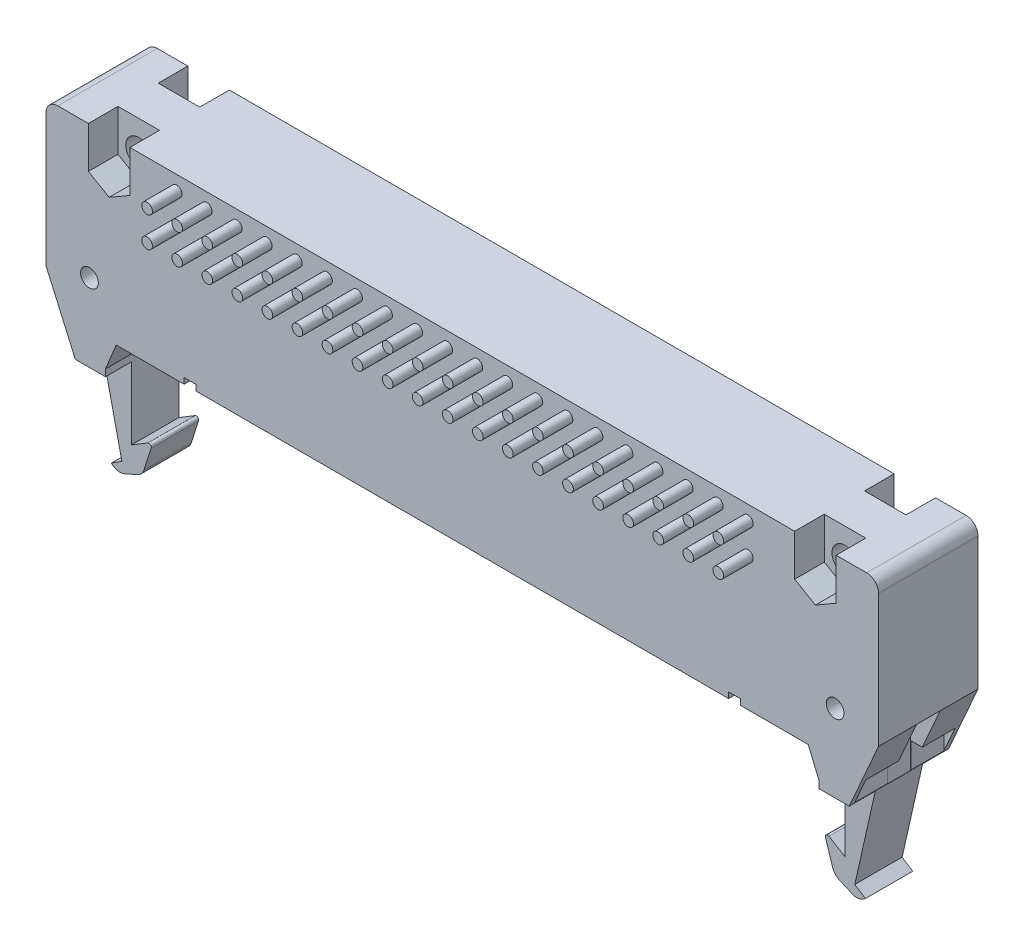
from build123d import *

# Parameters (mm, degrees)
EXTRUDE_1_DEPTH      = 8.4
SKETCH_2_W           = 3.875941336
SKETCH_2_H           = 10.635716013
CUT_EXTRUDE_1_DEPTH  = 150
SKETCH_3_W           = 2
SKETCH_3_H           = 5.614214587
CUT_EXTRUDE_2_DEPTH  = 2.5
SKETCH_4_W           = 7.533258122
SKETCH_4_H           = 2.2
CUT_EXTRUDE_3_DEPTH  = 2.45
SKETCH_5_W           = 2
SKETCH_5_H           = 5.614214587
CUT_EXTRUDE_4_DEPTH  = 2.5
SKETCH_6_W           = 2.766629061
SKETCH_6_H           = 2.133374911
CUT_EXTRUDE_5_DEPTH  = 2.45
SKETCH_7_W           = 58.464474368
SKETCH_7_H           = 5.5
CUT_EXTRUDE_6_DEPTH  = 10
SKETCH_8_R           = 0.45
EXTRUDE_2_DEPTH      = 8
SKETCH_9_R           = 1.1
SKETCH_9_R_2         = 0.75
SKETCH_9_W           = 1
SKETCH_9_H           = 0.97451262
CUT_EXTRUDE_7_DEPTH  = 10
SKETCH_10_W          = 52
SKETCH_10_H          = 2
CUT_EXTRUDE_8_DEPTH  = 2.5
CUT_EXTRUDE_9_DEPTH  = 2.5
SKETCH_12_W          = 4.6
SKETCH_12_H          = 9.297061896
CUT_EXTRUDE_10_DEPTH = 1.45
CHAMFER_1_SIZE       = 2
CUT_EXTRUDE_11_DEPTH = 0.2
SKETCH_14_R          = 0.45
EXTRUDE_3_DEPTH      = 2.5


with BuildPart() as part:
    # Эскиз1 → Вытянуть1 (new body)
    with BuildSketch(Plane.XY):
        with BuildLine():
            Line((-30.146127527, -11.858221261), (-29.232237184, -9.652950274))
            Line((-29.232237184, -9.652950274), (29.232237184, -9.652950274))
            Line((29.232237184, -9.652950274), (30.146127527, -11.858221261))
            Line((30.146127527, -11.858221261), (30.146127527, -18.516991449))
            Line((30.146127527, -18.516991449), (28.775858863, -17.684929687))
            ThreePointArc((28.775858863, -17.684929687), (28.548249479, -17.698805472), (28.481580168, -17.916873745))
            Line((28.481580168, -17.916873745), (29.095129243, -19.832909478))
            ThreePointArc((29.095129243, -19.832909478), (29.303928896, -20.196609982), (29.643503167, -20.442708876))
            Line((29.643503167, -20.442708876), (30.720929857, -20.918536331))
            ThreePointArc((30.720929857, -20.918536331), (31.234592927, -20.997740615), (31.718630756, -20.808451293))
            Line((31.718630756, -20.808451293), (31.856110829, -20.707015208))
            Line((31.856110829, -20.707015208), (30.960442561, -20.125628034))
            Line((30.960442561, -20.125628034), (32.690576145, -12.430286305))
            Line((32.690576145, -12.430286305), (35.17, -6.816071718))
            Line((35.17, -6.816071718), (35.17, 4.381463669))
            ThreePointArc((35.17, 4.381463669), (34.877106781, 5.08857045), (34.17, 5.381463669))
            Line((34.17, 5.381463669), (-34.17, 5.381463669))
            ThreePointArc((-34.17, 5.381463669), (-34.877106781, 5.08857045), (-35.17, 4.381463669))
            Line((-35.17, 4.381463669), (-35.17, -6.816071718))
            Line((-35.17, -6.816071718), (-32.690576145, -12.430286305))
            Line((-32.690576145, -12.430286305), (-30.960442561, -20.125628034))
            Line((-30.960442561, -20.125628034), (-31.856110829, -20.707015208))
            Line((-31.856110829, -20.707015208), (-31.718630756, -20.808451293))
            ThreePointArc((-31.718630756, -20.808451293), (-31.234592927, -20.997740615), (-30.720929857, -20.918536331))
            Line((-30.720929857, -20.918536331), (-29.643503167, -20.442708876))
            ThreePointArc((-29.643503167, -20.442708876), (-29.303928896, -20.196609982), (-29.095129243, -19.832909478))
            Line((-29.095129243, -19.832909478), (-28.481580168, -17.916873745))
            ThreePointArc((-28.481580168, -17.916873745), (-28.548249479, -17.698805472), (-28.775858863, -17.684929687))
            Line((-28.775858863, -17.684929687), (-30.146127527, -18.516991449))
            Line((-30.146127527, -18.516991449), (-30.146127527, -11.858221261))
        make_face()
    extrude(amount=EXTRUDE_1_DEPTH)

    # Эскиз2 → Вырез-Вытянуть1 (cut)
    with BuildSketch(Plane(origin=(35.17, 0, 0), x_dir=(0, 0, -1), z_dir=(1, 0, 0))):
        with Locations((-8.137970668, -17.748144312)):
            Rectangle(SKETCH_2_W, SKETCH_2_H)
        with Locations((-0.262029332, -17.748144312)):
            Rectangle(SKETCH_2_W, SKETCH_2_H)
    extrude(amount=-CUT_EXTRUDE_1_DEPTH, mode=Mode.SUBTRACT)

    # Эскиз3 → Вырез-Вытянуть2 (cut)
    with BuildSketch(Plane(origin=(35.17, 0, 0), x_dir=(0, 0, -1), z_dir=(1, 0, 0))):
        with Locations((-4.2, -9.623179012)):
            Rectangle(SKETCH_3_W, SKETCH_3_H)
    extrude(amount=-CUT_EXTRUDE_2_DEPTH, mode=Mode.SUBTRACT)

    # Эскиз4 → Вырез-Вытянуть3 (cut)
    with BuildSketch(Plane(origin=(35.17, 0, 0), x_dir=(0, 0, -1), z_dir=(1, 0, 0))):
        with Locations((-4.2, -11.330286305)):
            Rectangle(SKETCH_4_W, SKETCH_4_H)
    extrude(amount=-CUT_EXTRUDE_3_DEPTH, mode=Mode.SUBTRACT)

    # Эскиз5 → Вырез-Вытянуть4 (cut)
    with BuildSketch(Plane.ZY.offset(35.17)):
        with Locations((4.2, -9.623179012)):
            Rectangle(SKETCH_5_W, SKETCH_5_H)
    extrude(amount=-CUT_EXTRUDE_4_DEPTH, mode=Mode.SUBTRACT)

    # Эскиз6 → Вырез-Вытянуть5 (cut)
    with BuildSketch(Plane.ZY.offset(35.17)):
        with Locations((6.583314531, -11.296973761)):
            Rectangle(SKETCH_6_W, SKETCH_6_H)
        with Locations((1.81668547, -11.296973761)):
            Rectangle(SKETCH_6_W, SKETCH_6_H)
    extrude(amount=-CUT_EXTRUDE_5_DEPTH, mode=Mode.SUBTRACT)

    # Эскиз7 → Вырез-Вытянуть6 (cut)
    with BuildSketch(Plane.XZ.offset(9.652950274)):
        with Locations((0, 4.2)):
            Rectangle(SKETCH_7_W, SKETCH_7_H)
    extrude(amount=-CUT_EXTRUDE_6_DEPTH, mode=Mode.SUBTRACT)

    # Эскиз8 → Вытянуть2 (add)
    with BuildSketch(Plane.XZ.offset(-0.347049726)):
        with Locations(Location((6.35, 2.93, 0), (0, 0, 180))):
            Circle(SKETCH_8_R)
        with Locations(Location((6.35, 5.47, 0), (0, 0, 180))):
            Circle(SKETCH_8_R)
        with Locations(Location((1.27, 5.47, 0), (0, 0, 180))):
            Circle(SKETCH_8_R)
        with Locations(Location((1.27, 2.93, 0), (0, 0, 180))):
            Circle(SKETCH_8_R)
        with Locations(Location((3.81, 5.47, 0), (0, 0, 180))):
            Circle(SKETCH_8_R)
        with Locations(Location((3.81, 2.93, 0), (0, 0, 180))):
            Circle(SKETCH_8_R)
        with Locations(Location((-1.27, 5.47, 0), (0, 0, 180))):
            Circle(SKETCH_8_R)
        with Locations(Location((-1.27, 2.93, 0), (0, 0, 180))):
            Circle(SKETCH_8_R)
        with Locations(Location((-3.81, 5.47, 0), (0, 0, 180))):
            Circle(SKETCH_8_R)
        with Locations(Location((-3.81, 2.93, 0), (0, 0, 180))):
            Circle(SKETCH_8_R)
        with Locations(Location((8.89, 2.93, 0), (0, 0, 180))):
            Circle(SKETCH_8_R)
        with Locations(Location((8.89, 5.47, 0), (0, 0, 180))):
            Circle(SKETCH_8_R)
        with Locations(Location((11.43, 2.93, 0), (0, 0, 180))):
            Circle(SKETCH_8_R)
        with Locations(Location((11.43, 5.47, 0), (0, 0, 180))):
            Circle(SKETCH_8_R)
        with Locations(Location((-6.35, 5.47, 0), (0, 0, 180))):
            Circle(SKETCH_8_R)
        with Locations(Location((-6.35, 2.93, 0), (0, 0, 180))):
            Circle(SKETCH_8_R)
        with Locations(Location((-8.89, 5.47, 0), (0, 0, 180))):
            Circle(SKETCH_8_R)
        with Locations(Location((-8.89, 2.93, 0), (0, 0, 180))):
            Circle(SKETCH_8_R)
        with Locations(Location((-11.43, 5.47, 0), (0, 0, 180))):
            Circle(SKETCH_8_R)
        with Locations(Location((-11.43, 2.93, 0), (0, 0, 180))):
            Circle(SKETCH_8_R)
        with Locations(Location((-13.97, 2.93, 0), (0, 0, 180))):
            Circle(SKETCH_8_R)
        with Locations(Location((-13.97, 5.47, 0), (0, 0, 180))):
            Circle(SKETCH_8_R)
        with Locations(Location((-16.51, 2.93, 0), (0, 0, 180))):
            Circle(SKETCH_8_R)
        with Locations(Location((-16.51, 5.47, 0), (0, 0, 180))):
            Circle(SKETCH_8_R)
        with Locations(Location((-19.05, 2.93, 0), (0, 0, 180))):
            Circle(SKETCH_8_R)
        with Locations(Location((-19.05, 5.47, 0), (0, 0, 180))):
            Circle(SKETCH_8_R)
        with Locations(Location((-21.59, 2.93, 0), (0, 0, 180))):
            Circle(SKETCH_8_R)
        with Locations(Location((-21.59, 5.47, 0), (0, 0, 180))):
            Circle(SKETCH_8_R)
        with Locations(Location((-24.13, 2.93, 0), (0, 0, 180))):
            Circle(SKETCH_8_R)
        with Locations(Location((-24.13, 5.47, 0), (0, 0, 180))):
            Circle(SKETCH_8_R)
        with Locations(Location((13.97, 2.93, 0), (0, 0, 180))):
            Circle(SKETCH_8_R)
        with Locations(Location((13.97, 5.47, 0), (0, 0, 180))):
            Circle(SKETCH_8_R)
        with Locations(Location((16.51, 2.93, 0), (0, 0, 180))):
            Circle(SKETCH_8_R)
        with Locations(Location((16.51, 5.47, 0), (0, 0, 180))):
            Circle(SKETCH_8_R)
        with Locations(Location((19.05, 2.93, 0), (0, 0, 180))):
            Circle(SKETCH_8_R)
        with Locations(Location((19.05, 5.47, 0), (0, 0, 180))):
            Circle(SKETCH_8_R)
        with Locations(Location((21.59, 2.93, 0), (0, 0, 180))):
            Circle(SKETCH_8_R)
        with Locations(Location((21.59, 5.47, 0), (0, 0, 180))):
            Circle(SKETCH_8_R)
        with Locations(Location((24.13, 2.93, 0), (0, 0, 180))):
            Circle(SKETCH_8_R)
        with Locations(Location((24.13, 5.47, 0), (0, 0, 180))):
            Circle(SKETCH_8_R)
    extrude(amount=EXTRUDE_2_DEPTH)

    # Эскиз9 → Вырез-Вытянуть7 (cut)
    with BuildSketch(Plane(origin=(0, 0, 0), x_dir=(-1, 0, 0), z_dir=(0, 0, -1))):
        with Locations((-29.835, 2.881463669)):
            Circle(SKETCH_9_R)
        with Locations((29.835, 2.881463669)):
            Circle(SKETCH_9_R)
        with Locations((-31.5, -5.867574023)):
            Circle(SKETCH_9_R_2)
        with Locations((31.5, -5.867574023)):
            Circle(SKETCH_9_R_2)
        with Locations((23, -9.651420054)):
            Rectangle(SKETCH_9_W, SKETCH_9_H)
        with Locations((-23, -9.651420054)):
            Rectangle(SKETCH_9_W, SKETCH_9_H)
    extrude(amount=-CUT_EXTRUDE_7_DEPTH, mode=Mode.SUBTRACT)

    # Эскиз10 → Вырез-Вытянуть8 (cut)
    with BuildSketch(Plane(origin=(0, 0, 0), x_dir=(-1, 0, 0), z_dir=(0, 0, -1))):
        Polygon((-31.589432173, 3.987610768), (-31.589432173, 6.55660708), (-28.080567827, 6.55660708), (-28.080567827, 3.987610768), (-28.080567827, 1.868541782), (-29.835, 0.855619895), (-31.589432173, 1.868541782), align=None)
        Polygon((28.080567827, 6.55660708), (28.080567827, 3.987610768), (28.080567827, 1.868541782), (29.835, 0.855619895), (31.589432173, 1.868541782), (31.589432173, 3.987610768), (31.589432173, 6.55660708), align=None)
        with Locations((0, 2.868541782)):
            Rectangle(SKETCH_10_W, SKETCH_10_H)
    extrude(amount=-CUT_EXTRUDE_8_DEPTH, mode=Mode.SUBTRACT)

    # Эскиз11 → Вырез-Вытянуть9 (cut)
    with BuildSketch(Plane.XY.offset(8.4)):
        Polygon((31.589432173, 1.868541782), (31.589432173, 5.381463669), (28.080567827, 5.381463669), (28.080567827, 1.868541782), (29.835, 0.855619895), align=None)
        Polygon((-28.080567827, 5.381463669), (-31.589432173, 5.381463669), (-31.589432173, 1.868541782), (-29.835, 0.855619895), (-28.080567827, 1.868541782), align=None)
    extrude(amount=-CUT_EXTRUDE_9_DEPTH, mode=Mode.SUBTRACT)

    # Эскиз12 → Вырез-Вытянуть10 (cut)
    with BuildSketch(Plane(origin=(0, 0, 0), x_dir=(-1, 0, 0), z_dir=(0, 0, -1))):
        with Locations((0, -6.301481222)):
            Rectangle(SKETCH_12_W, SKETCH_12_H)
    extrude(amount=-CUT_EXTRUDE_10_DEPTH, mode=Mode.SUBTRACT)

    # Фаска1
    # the kernel refuses this chamfer: 2 mm, written as the material it takes off along each edge
    with BuildSketch(Plane(origin=(-2.3, -1.652950274, 0), x_dir=(0, 0.9996219169112968, -0.027495876610586365), z_dir=(1, 0, 0))) as chamfer_1_piece_1:
        Polygon((CHAMFER_1_SIZE * 0.999621916911, CHAMFER_1_SIZE * 0.0274958766106), (-CHAMFER_1_SIZE * 0.0274958766106, CHAMFER_1_SIZE * 0.999621916911), (0, 0), align=None)
    extrude(amount=4.6, mode=Mode.SUBTRACT)

    # Эскиз13 → Вырез-Вытянуть11 (cut)
    with BuildSketch(Plane(origin=(0, 0, 0), x_dir=(-1, 0, 0), z_dir=(0, 0, -1))):
        Polygon((25.21171311, -9.652950274), (26.175156443, -9.652950274), (25.693434776, -8.818583872), align=None)
    extrude(amount=-CUT_EXTRUDE_11_DEPTH, mode=Mode.SUBTRACT)

    # Эскиз14 → Вытянуть3 (add)
    with BuildSketch(Plane.XY.offset(8.4)):
        with Locations(Location((6.35, 4.151463669, 0), (0, 0, 180))):
            Circle(SKETCH_14_R)
        with Locations(Location((6.35, 1.611463669, 0), (0, 0, 180))):
            Circle(SKETCH_14_R)
        with Locations(Location((1.27, 4.151463669, 0), (0, 0, 180))):
            Circle(SKETCH_14_R)
        with Locations(Location((1.27, 1.611463669, 0), (0, 0, 180))):
            Circle(SKETCH_14_R)
        with Locations(Location((3.81, 4.151463669, 0), (0, 0, 180))):
            Circle(SKETCH_14_R)
        with Locations(Location((3.81, 1.611463669, 0), (0, 0, 180))):
            Circle(SKETCH_14_R)
        with Locations(Location((-1.27, 4.151463669, 0), (0, 0, 180))):
            Circle(SKETCH_14_R)
        with Locations(Location((-1.27, 1.611463669, 0), (0, 0, 180))):
            Circle(SKETCH_14_R)
        with Locations(Location((-3.81, 4.151463669, 0), (0, 0, 180))):
            Circle(SKETCH_14_R)
        with Locations(Location((-3.81, 1.611463669, 0), (0, 0, 180))):
            Circle(SKETCH_14_R)
        with Locations(Location((8.89, 4.151463669, 0), (0, 0, 180))):
            Circle(SKETCH_14_R)
        with Locations(Location((8.89, 1.611463669, 0), (0, 0, 180))):
            Circle(SKETCH_14_R)
        with Locations(Location((11.43, 4.151463669, 0), (0, 0, 180))):
            Circle(SKETCH_14_R)
        with Locations(Location((11.43, 1.611463669, 0), (0, 0, 180))):
            Circle(SKETCH_14_R)
        with Locations(Location((-6.35, 1.611463669, 0), (0, 0, 180))):
            Circle(SKETCH_14_R)
        with Locations(Location((-6.35, 4.151463669, 0), (0, 0, 180))):
            Circle(SKETCH_14_R)
        with Locations(Location((-8.89, 1.611463669, 0), (0, 0, 180))):
            Circle(SKETCH_14_R)
        with Locations(Location((-8.89, 4.151463669, 0), (0, 0, 180))):
            Circle(SKETCH_14_R)
        with Locations(Location((-11.43, 1.611463669, 0), (0, 0, 180))):
            Circle(SKETCH_14_R)
        with Locations(Location((-11.43, 4.151463669, 0), (0, 0, 180))):
            Circle(SKETCH_14_R)
        with Locations(Location((13.97, 1.611463669, 0), (0, 0, 180))):
            Circle(SKETCH_14_R)
        with Locations(Location((13.97, 4.151463669, 0), (0, 0, 180))):
            Circle(SKETCH_14_R)
        with Locations(Location((16.51, 1.611463669, 0), (0, 0, 180))):
            Circle(SKETCH_14_R)
        with Locations(Location((16.51, 4.151463669, 0), (0, 0, 180))):
            Circle(SKETCH_14_R)
        with Locations(Location((19.05, 1.611463669, 0), (0, 0, 180))):
            Circle(SKETCH_14_R)
        with Locations(Location((19.05, 4.151463669, 0), (0, 0, 180))):
            Circle(SKETCH_14_R)
        with Locations(Location((21.59, 1.611463669, 0), (0, 0, 180))):
            Circle(SKETCH_14_R)
        with Locations(Location((21.59, 4.151463669, 0), (0, 0, 180))):
            Circle(SKETCH_14_R)
        with Locations(Location((24.13, 1.611463669, 0), (0, 0, 180))):
            Circle(SKETCH_14_R)
        with Locations(Location((24.13, 4.151463669, 0), (0, 0, 180))):
            Circle(SKETCH_14_R)
        with Locations(Location((-13.97, 1.611463669, 0), (0, 0, 180))):
            Circle(SKETCH_14_R)
        with Locations(Location((-13.97, 4.151463669, 0), (0, 0, 180))):
            Circle(SKETCH_14_R)
        with Locations(Location((-16.51, 1.611463669, 0), (0, 0, 180))):
            Circle(SKETCH_14_R)
        with Locations(Location((-16.51, 4.151463669, 0), (0, 0, 180))):
            Circle(SKETCH_14_R)
        with Locations(Location((-19.05, 1.611463669, 0), (0, 0, 180))):
            Circle(SKETCH_14_R)
        with Locations(Location((-19.05, 4.151463669, 0), (0, 0, 180))):
            Circle(SKETCH_14_R)
        with Locations(Location((-21.59, 1.611463669, 0), (0, 0, 180))):
            Circle(SKETCH_14_R)
        with Locations(Location((-21.59, 4.151463669, 0), (0, 0, 180))):
            Circle(SKETCH_14_R)
        with Locations(Location((-24.13, 1.611463669, 0), (0, 0, 180))):
            Circle(SKETCH_14_R)
        with Locations(Location((-24.13, 4.151463669, 0), (0, 0, 180))):
            Circle(SKETCH_14_R)
    extrude(amount=EXTRUDE_3_DEPTH)


solid = part.part
